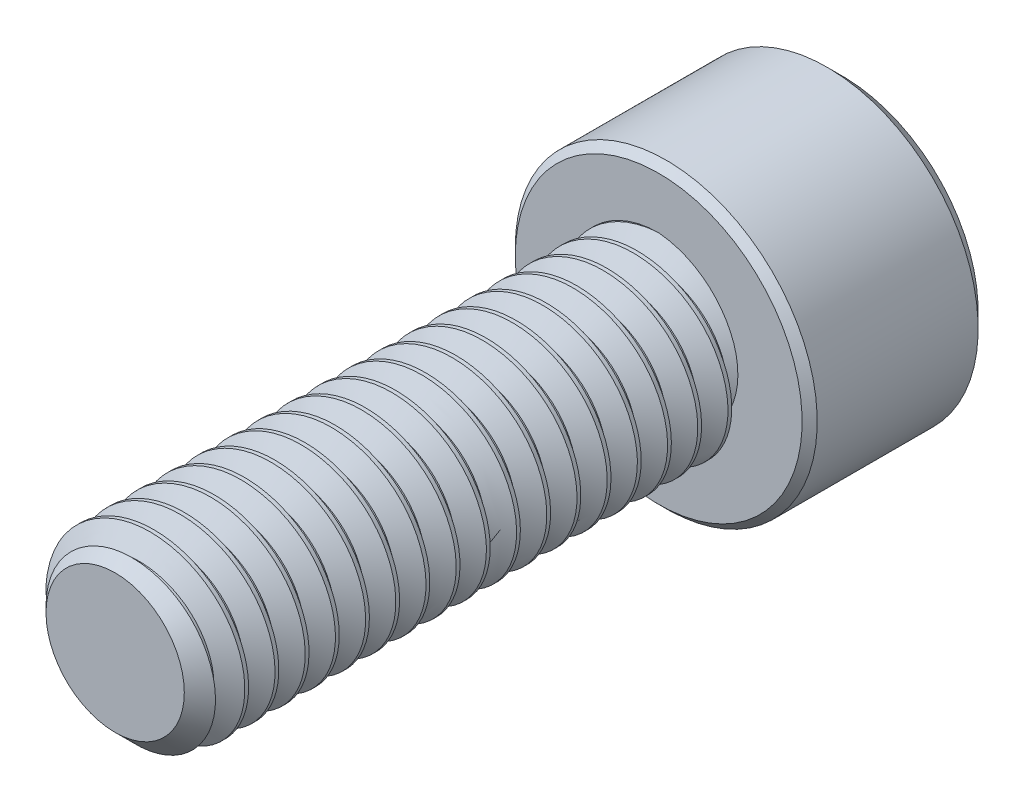
from build123d import *

# Parameters (mm, degrees)
SKETCH1_R          = 2.413
EXTRUDE1_DEPTH     = 14.2875
CHAMFER3_SIZE      = 0.5953125
CUT_SWEEP1_PITCH   = 0.79375
SKETCH6_R          = 3.96875
EXTRUDE2_DEPTH     = 4.826
CUT_EXTRUDE1_DEPTH = 2.9765625
CHAMFER1_SIZE      = 0.396875
CHAMFER2_SIZE      = 0.1984375


with BuildPart() as part:
    # Sketch1 → Extrude1 (new body)
    with BuildSketch(Plane.XY):
        Circle(SKETCH1_R)
    extrude(amount=-EXTRUDE1_DEPTH)

    # Chamfer3
    chamfer3_edges = [part.edges().sort_by_distance(p)[0] for p in [
        (-2.413, 0, 0),
    ]]
    chamfer(chamfer3_edges, length=CHAMFER3_SIZE)

    # Cut-Sweep1: the profile of Sketch3 profile screwed along a right-hand helix of 19 turns, 6 arcs to a turn; built about Z, then put on its axis
    cut_sweep1_z = Axis((0, 0, 0), (0, 0, 1))
    cut_sweep1_corners = [(2.4133, 0, -0.694704455), (1.897444252, 0, -0.396875), (1.897444252, 0, -0.29765625), (2.4133, 0, 0.000173205)]
    with BuildLine(mode=Mode.PRIVATE) as cut_sweep1_profile:
        Line(cut_sweep1_corners[0], cut_sweep1_corners[1])
        Line(cut_sweep1_corners[1], cut_sweep1_corners[2])
        Line(cut_sweep1_corners[2], cut_sweep1_corners[3])
        Line(cut_sweep1_corners[3], cut_sweep1_corners[0])
    cut_sweep1_cap = Face(cut_sweep1_profile.wire())
    cut_sweep1_turn_angles = [0, 30, 60, 90, 120, 150, 180, 210, 240, 270, 300, 330, 360]
    cut_sweep1_turn_weights = [1, 0.8660254037844387, 1, 0.8660254037844387, 1, 0.8660254037844387, 1, 0.8660254037844387, 1, 0.8660254037844387, 1, 0.8660254037844387, 1]
    cut_sweep1_turn_rails = [Edge.make_bspline([Vector(p[0], p[1], 0).rotate(cut_sweep1_z, cut_sweep1_turn_angles[k]) / cut_sweep1_turn_weights[k] + Vector(0, 0, p[2] + CUT_SWEEP1_PITCH * cut_sweep1_turn_angles[k] / 360) for k in range(13)], [0, 0, 0, 1, 1, 2, 2, 3, 3, 4, 4, 5, 5, 6, 6, 6], 2, cut_sweep1_turn_weights) for p in cut_sweep1_corners]
    cut_sweep1_turn_sides = [Face.make_surface_from_curves(cut_sweep1_turn_rails[p[0]], cut_sweep1_turn_rails[p[1]]) for p in [(0, 1), (1, 2), (2, 3), (3, 0)]]
    cut_sweep1 = Plane(origin=(0, 0, 0), x_dir=(0, 1, 0), z_dir=(0, 0, -1)) * Solid(Shell([*[p.moved(Location((0, 0, CUT_SWEEP1_PITCH * i))) for i in range(19) for p in cut_sweep1_turn_sides], cut_sweep1_cap, cut_sweep1_cap.rotate(cut_sweep1_z, 6840).moved(Location((0, 0, CUT_SWEEP1_PITCH * 6840 / 360)))]))
    add(cut_sweep1, mode=Mode.SUBTRACT)

    # Sketch6 → Extrude2 (add)
    with BuildSketch(Plane(origin=(0, 0, -14.2875), x_dir=(-1, 0, 0), z_dir=(0, 0, -1))):
        Circle(SKETCH6_R)
    extrude(amount=EXTRUDE2_DEPTH)

    # Sketch7 → Cut-Extrude1 (cut)
    with BuildSketch(Plane(origin=(0, 0, -19.1135), x_dir=(-1, 0, 0), z_dir=(0, 0, -1))):
        Polygon((0, 2.291358881), (-1.984375, 1.14567944), (-1.984375, -1.14567944), (0, -2.291358881), (1.984375, -1.14567944), (1.984375, 1.14567944), align=None)
    extrude(amount=-CUT_EXTRUDE1_DEPTH, mode=Mode.SUBTRACT)

    # Cut-Extrude2 cone 1 section (through the dimple's axis) → Cut-Extrude2 (revolve, cut)
    with BuildSketch(Plane(origin=(0, 0, -19.1135), x_dir=(0, 1, 0), z_dir=(1, 0, 0))):
        Polygon((0, 0), (2.291358881, 0), (0, 2.291358881), align=None)
    revolve(axis=Axis((0, 0, -19.1135), (0, 0, 1)), mode=Mode.SUBTRACT)

    # Chamfer1
    chamfer1_edges = [part.edges().sort_by_distance(p)[0] for p in [
        (3.96875, 0, -19.1135),
    ]]
    chamfer(chamfer1_edges, length=CHAMFER1_SIZE)

    # Chamfer2
    chamfer2_edges = [part.edges().sort_by_distance(p)[0] for p in [
        (3.96875, 0, -14.2875),
    ]]
    chamfer(chamfer2_edges, length=CHAMFER2_SIZE)


solid = part.part
